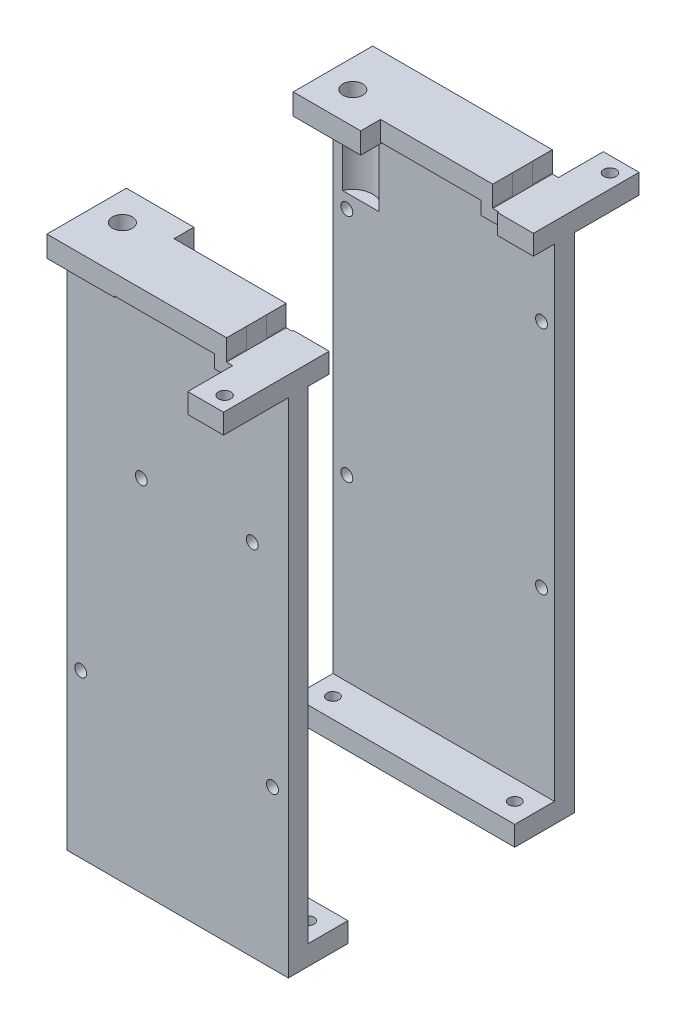
from build123d import *

# Parameters (mm, degrees)
EXTRUDE_1_OUTLINE_R = 2.5
EXTRUDE_1_DEPTH     = 5.3
SKETCH_2_R          = 1.55
EXTRUDE_2_DEPTH     = 5
SKETCH_3_W          = 55.770566096
SKETCH_3_H          = 5
EXTRUDE_3_DEPTH     = 126.5
SKETCH_4_R          = 5
CUT_EXTRUDE_1_DEPTH = 20
SKETCH_5_W          = 28.229480684
SKETCH_5_H          = 5
EXTRUDE_4_DEPTH     = 5
EXTRUDE_5_DEPTH     = 5
EXTRUDE_6_DEPTH     = 5
SKETCH_8_W          = 55.770566096
SKETCH_8_H          = 10
SKETCH_8_R          = 1.5
EXTRUDE_7_DEPTH     = 5
SKETCH_9_R          = 1.5
CUT_EXTRUDE_2_DEPTH = 5
SKETCH_10_R         = 1.5
CUT_EXTRUDE_3_DEPTH = 10


# Read off the part's stored shape, not the designer's step: 填料-伸長1
with BuildPart() as part:
    # 填料-伸長1 outline → 填料-伸長1 (new body)
    with BuildSketch(Plane.XZ.offset(-131.641882403)):
        Polygon((-134.707905988, -40.915289206), (-134.707905988, -60.915289206), (-117.707905988, -60.915289206), (-117.707905988, -55.915289206), (-89.473538161, -55.915289206), (-89.473538161, -50.915289206), (-117.707905988, -50.915289206), (-117.707905988, -40.915289206), align=None)
        with Locations((-127.707905988, -48.915289206)):
            Circle(EXTRUDE_1_OUTLINE_R, mode=Mode.SUBTRACT)
    extrude(amount=EXTRUDE_1_DEPTH)

    # 草圖2 → 填料-伸長2 (add)
    with BuildSketch(Plane.XZ.offset(-126.341882403)):
        Polygon((-122.707905988, -50.915289206), (-134.707905988, -50.915289206), (-134.707905988, -55.915289206), (-117.707905988, -55.915289206), (-89.473538161, -55.915289206), (-87.937339892, -55.915289206), (-87.937339892, -72.215289206), (-85.473538161, -72.215289206), (-78.937339892, -72.215289206), (-78.937339892, -55.915289206), (-78.937339892, -50.915289206), (-78.937339892, -45.615289206), (-87.937339892, -45.615289206), (-87.937339892, -50.915289206), (-89.473538161, -50.915289206), (-117.707905988, -50.915289206), align=None)
        with Locations(Location((-82.473538161, -68.415289206, 0), (0, 0, 270))):
            Circle(SKETCH_2_R, mode=Mode.SUBTRACT)
    extrude(amount=EXTRUDE_2_DEPTH)

    # 草圖3 → 填料-伸長3 (add)
    with BuildSketch(Plane.XZ.offset(-121.341882403)):
        with Locations((-106.82262294, -53.415289206)):
            Rectangle(SKETCH_3_W, SKETCH_3_H)
    extrude(amount=EXTRUDE_3_DEPTH)

    # 草圖4 → 除料-伸長1 (cut)
    with BuildSketch(Plane.XZ.offset(-126.341882403)):
        with Locations((-127.707905988, -48.915289206)):
            Circle(SKETCH_4_R)
    extrude(amount=CUT_EXTRUDE_1_DEPTH, mode=Mode.SUBTRACT)

    # 草圖5 → 填料-伸長4 (add)
    with BuildSketch(Plane.XZ.offset(-131.641882403)):
        with Locations((-103.593165646, -58.415289206)):
            Rectangle(SKETCH_5_W, SKETCH_5_H)
        with Locations((-103.593165646, -48.415289206)):
            Rectangle(SKETCH_5_W, SKETCH_5_H)
    extrude(amount=EXTRUDE_4_DEPTH)

    # 草圖6 → 填料-伸長5 (add)
    with BuildSketch(Plane(origin=(0, 0, -55.915289206), x_dir=(-1, 0, 0), z_dir=(0, 0, -1))):
        Polygon((89.478425304, 126.641882403), (89.473538161, 126.341882403), (87.937339892, 126.341882403), (87.937339892, 123.341882403), (92.473538161, 123.341882403), (92.473538161, 126.641882403), align=None)
    extrude(amount=EXTRUDE_5_DEPTH)

    # 草圖7 → 填料-伸長6 (add)
    with BuildSketch(Plane.XY.offset(-50.915289206)):
        Polygon((-89.478425304, 126.641882403), (-89.473538161, 126.341882403), (-87.937339892, 126.341882403), (-87.937339892, 123.341882403), (-92.478425304, 123.341882403), (-92.478425304, 126.641882403), align=None)
    extrude(amount=EXTRUDE_6_DEPTH)


with BuildPart() as body_2:
    # 鏡射12: mirrored copy
    add(part.part.mirror(Plane.XY.offset(-19.915289206)))


with BuildPart() as part_1:
    add(part.part)

    add(body_2.part)  # 填料-伸長7 merges body 2
    # 草圖8 → 填料-伸長7 (add)
    # profile 1 of 2: a face of its own
    with BuildSketch(Plane.XZ.offset(5.158117597)):
        with Locations((-106.82262294, 6.084710794)):
            Rectangle(SKETCH_8_W, SKETCH_8_H)
        with Locations(Location((-129.707905988, 6.084710794, 0), (0, 0, 270))):
            Circle(SKETCH_8_R, mode=Mode.SUBTRACT)
        with Locations(Location((-83.937339892, 6.084710794, 0), (0, 0, 90))):
            Circle(SKETCH_8_R, mode=Mode.SUBTRACT)
    # profile 2 of 2: a face of its own
    with BuildSketch(Plane.XZ.offset(5.158117597)):
        with Locations((-106.82262294, -45.915289206)):
            Rectangle(SKETCH_8_W, SKETCH_8_H)
        with Locations(Location((-129.707905988, -45.915289206, 0), (0, 0, 90))):
            Circle(SKETCH_8_R, mode=Mode.SUBTRACT)
        with Locations(Location((-83.937339892, -45.915289206, 0), (0, 0, 270))):
            Circle(SKETCH_8_R, mode=Mode.SUBTRACT)
    extrude(amount=-EXTRUDE_7_DEPTH)

    # 草圖9 → 除料-伸長2 (cut)
    with BuildSketch(Plane(origin=(0, 0, -55.915289206), x_dir=(-1, 0, 0), z_dir=(0, 0, -1))):
        with Locations((131.207905988, 44.841882403)):
            Circle(SKETCH_9_R)
        with Locations((131.207905988, 102.841882403)):
            Circle(SKETCH_9_R)
        with Locations((82.207905988, 102.841882403)):
            Circle(SKETCH_9_R)
        with Locations((82.207905988, 44.841882403)):
            Circle(SKETCH_9_R)
    extrude(amount=-CUT_EXTRUDE_2_DEPTH, mode=Mode.SUBTRACT)

    # 草圖10 → 除料-伸長3 (cut)
    with BuildSketch(Plane.XY.offset(16.084710794)):
        with Locations((-88.017339892, 85.282727934)):
            Circle(SKETCH_10_R)
        with Locations((-115.957339892, 85.282727934)):
            Circle(SKETCH_10_R)
        with Locations((-131.197339892, 35.752727934)):
            Circle(SKETCH_10_R)
        with Locations((-82.937339892, 34.482727934)):
            Circle(SKETCH_10_R)
    extrude(amount=-CUT_EXTRUDE_3_DEPTH, mode=Mode.SUBTRACT)


solid = part_1.part
